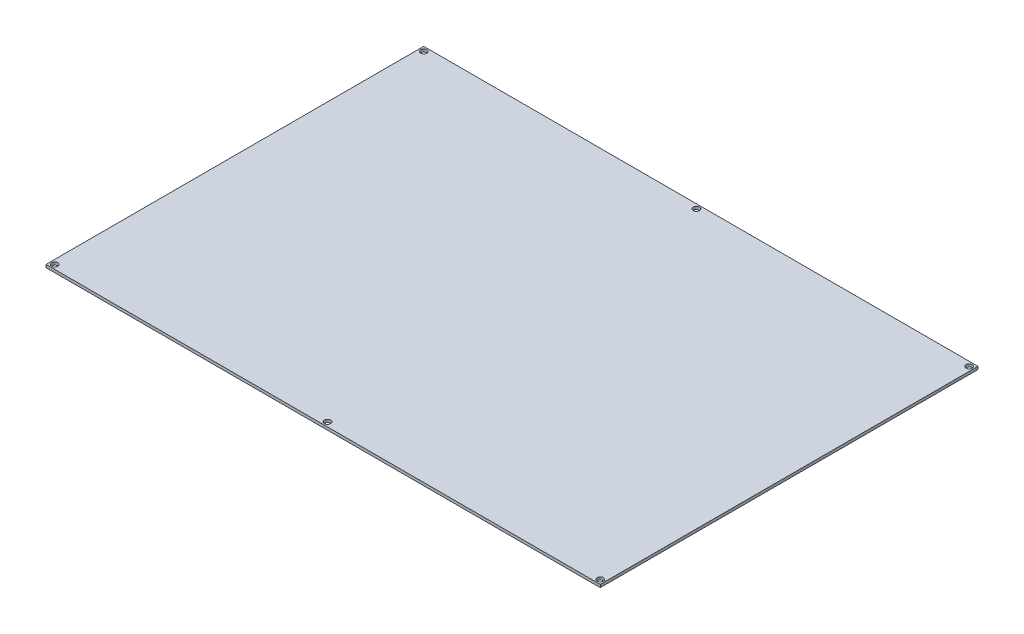
from build123d import *

# Parameters (mm, degrees)
SKETCH1_W           = 314
SKETCH1_H           = 214
BOSS_EXTRUDE1_DEPTH = 1.6
SKETCH2_R           = 1.75
CUT_EXTRUDE1_DEPTH  = 380.992842038


with BuildPart() as part:
    # Sketch1 → Boss-Extrude1 (new body)
    with BuildSketch(Plane(origin=(0, 0, 0), x_dir=(1, 0, 0), z_dir=(0, 1, 0))):
        with Locations((157, 107)):
            Rectangle(SKETCH1_W, SKETCH1_H)
    extrude(amount=BOSS_EXTRUDE1_DEPTH)

    # Sketch2 → Cut-Extrude1 (cut, through all)
    with BuildSketch(Plane(origin=(0, 1.6, 0), x_dir=(1, 0, 0), z_dir=(0, 1, 0))):
        with Locations((2.5, 2.5)):
            Circle(SKETCH2_R)
        with Locations((311.5, 2.5)):
            Circle(SKETCH2_R)
        with Locations((2.5, 211.5)):
            Circle(SKETCH2_R)
        with Locations((311.5, 211.5)):
            Circle(SKETCH2_R)
        with Locations((157, 2.5)):
            Circle(SKETCH2_R)
        with Locations((157, 211.5)):
            Circle(SKETCH2_R)
    extrude(amount=-CUT_EXTRUDE1_DEPTH, mode=Mode.SUBTRACT)


solid = part.part
